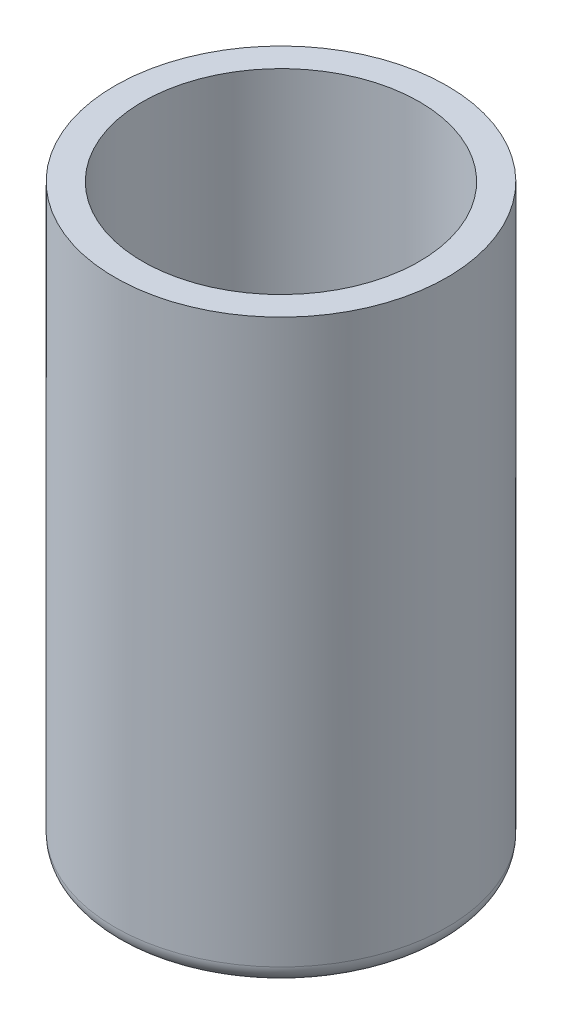
from build123d import *

# Parameters (mm, degrees)
FILLET_1_R = 2


with BuildPart() as part:
    # Эскиз1 → Повернуть1 (revolve)
    with BuildSketch(Plane.XY):
        Polygon((0, 0), (-18, 0), (-18, 63), (-15, 63), (-15, 3), (0, 3), align=None)
    revolve(axis=Axis((0, 3, 0), (0, 1, 0)))

    # Скругление1
    fillet_1_edges = [part.edges().sort_by_distance(p)[0] for p in [
        (18, 0, 0),
    ]]
    fillet(fillet_1_edges, radius=FILLET_1_R)


solid = part.part
